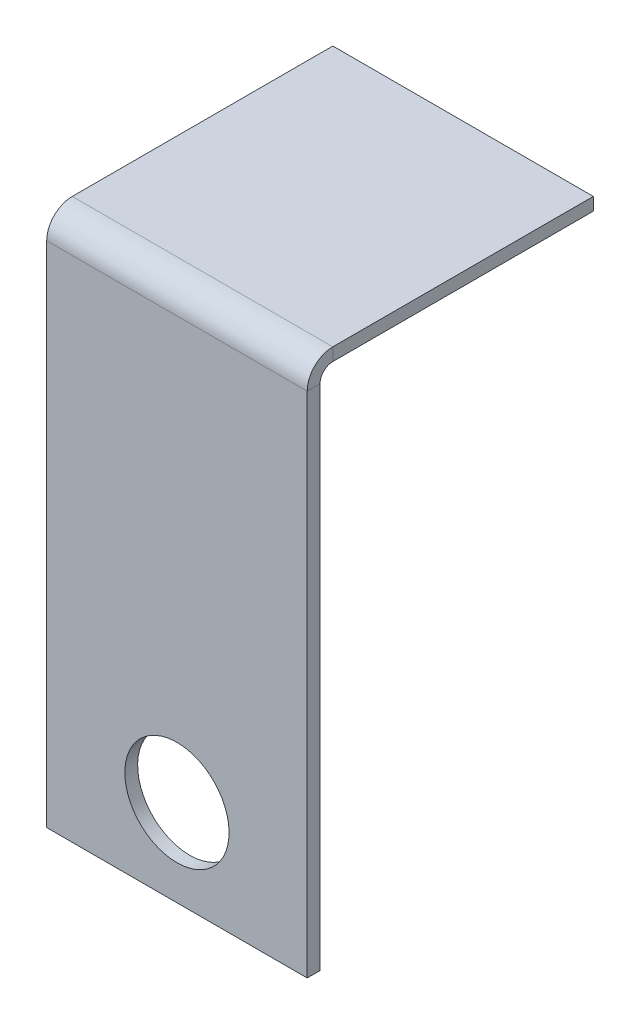
from build123d import *

# Parameters (mm, degrees)
SKETCH1_W               = 15
SKETCH1_H               = 15
BASE_FLANGE1_DEPTH      = 0.7366
EDGE_FLANGE1_DEPTH      = 15
EDGE_FLANGE1_START      = -0.7366
EDGE_FLANGE1_PROFILE_W  = 15
EDGE_FLANGE1_PROFILE_H  = 29.2634
EDGE_FLANGE1_PROFILE_R  = 3
EDGE_FLANGE1_FLAT_DEPTH = 0.7366


# Sheet-metal steps are written as plain solids
with BuildPart() as part:
    # Sketch1 → Base-Flange1 (new body)
    with BuildSketch(Plane(origin=(0, 0, 0), x_dir=(1, 0, 0), z_dir=(0, 1, 0))):
        Rectangle(SKETCH1_W, SKETCH1_H)
    extrude(amount=-BASE_FLANGE1_DEPTH)

    # Edge-Flange1 bend section (across the edge) → Edge-Flange1 (add)
    with BuildSketch(Plane(origin=(7.5, -0.7366, 8.2366), x_dir=(0, 0, -1), z_dir=(-1, 0, 0))):
        with BuildLine():
            Line((-0.7366, 0.7366), (0, 0.7366))
            ThreePointArc((0, 0.7366), (0.215745145, 0.215745145), (0.7366, 0))
            Line((0.7366, 0), (0.7366, -0.7366))
            ThreePointArc((0.7366, -0.7366), (-0.30510971, -0.30510971), (-0.7366, 0.7366))
        make_face()
    extrude(amount=EDGE_FLANGE1_DEPTH)

    # Edge-Flange1 profile (on flange) → Edge-Flange1 flat (add)
    with BuildSketch(Plane(origin=(0, -0.7366, 8.2366), x_dir=(1, 0, 0), z_dir=(0, 0, -1)).offset(EDGE_FLANGE1_START)):
        with Locations((0, 15.3683)):
            Rectangle(EDGE_FLANGE1_PROFILE_W, EDGE_FLANGE1_PROFILE_H)
        with Locations((0, 25)):
            Circle(EDGE_FLANGE1_PROFILE_R, mode=Mode.SUBTRACT)
    extrude(amount=EDGE_FLANGE1_FLAT_DEPTH)


solid = part.part
